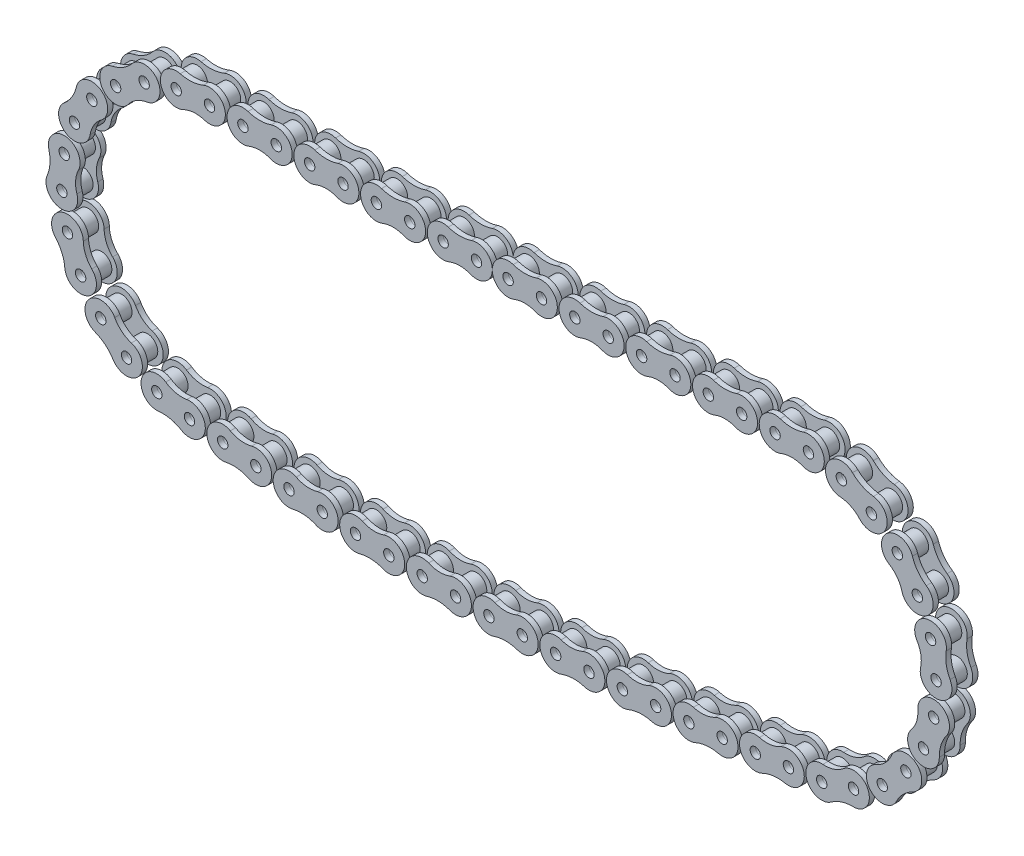
from build123d import *

# Parameters (mm, degrees)
SKETCH1_R            = 1.9812
BOSS_EXTRUDE1_DEPTH  = 2
SKETCH3_R            = 3.96367
SKETCH3_R_2          = 2.0574
BOSS_EXTRUDE2_DEPTH  = 7.9248
CRVPATTERN2_6_ANGLE  = 25.9221316
CRVPATTERN2_7_ANGLE  = 53.2058361
CRVPATTERN2_8_ANGLE  = 80.4895406
CRVPATTERN2_9_ANGLE  = 107.7732452
CRVPATTERN2_10_ANGLE = 135.0569497
CRVPATTERN2_11_ANGLE = 162.3406542
CRVPATTERN2_12_ANGLE = 172.9164261
CRVPATTERN2_13_ANGLE = 174.6442779
CRVPATTERN2_14_ANGLE = 176.3721297
CRVPATTERN2_15_ANGLE = 178.0999815
CRVPATTERN2_16_ANGLE = 179.8278334
CRVPATTERN2_17_ANGLE = 178.4443148
CRVPATTERN2_18_ANGLE = 176.716463
CRVPATTERN2_19_ANGLE = 174.9886112
CRVPATTERN2_20_ANGLE = 173.2607594
CRVPATTERN2_21_ANGLE = 167.7778612
CRVPATTERN2_22_ANGLE = 140.4941566
CRVPATTERN2_23_ANGLE = 113.2104521
CRVPATTERN2_24_ANGLE = 85.9267476
CRVPATTERN2_25_ANGLE = 58.643043
CRVPATTERN2_26_ANGLE = 31.3593385
CRVPATTERN2_27_ANGLE = 4.075634


with BuildPart() as part:
    # Sketch1 → Boss-Extrude1 (new body)
    with BuildSketch(Plane.XY):
        with BuildLine():
            ThreePointArc((-8.065136179, 5.713786682), (-16.0301374, -0.168817037), (-7.748496003, -5.596586996))
            ThreePointArc((-7.748496003, -5.596586996), (-3.65, -4.803078431), (0.448496003, -5.596586996))
            ThreePointArc((0.448496003, -5.596586996), (8.7301374, -0.168817037), (0.765136179, 5.713786682))
            ThreePointArc((0.765136179, 5.713786682), (-3.65, 4.986519632), (-8.065136179, 5.713786682))
        make_face()
        with Locations((-10, 0)):
            Circle(SKETCH1_R, mode=Mode.SUBTRACT)
        with Locations(Location((2.7, 0, 0), (0, 0, 180))):
            Circle(SKETCH1_R, mode=Mode.SUBTRACT)
    boss_extrude1 = extrude(amount=BOSS_EXTRUDE1_DEPTH)

    # Sketch3 → Boss-Extrude2 (add)
    # profile 1 of 2: a face of its own
    with BuildSketch(Plane.XY):
        with Locations((-10, 0)):
            Circle(SKETCH3_R)
        with Locations((-10, 0)):
            Circle(SKETCH3_R_2, mode=Mode.SUBTRACT)
    # profile 2 of 2: a face of its own
    with BuildSketch(Plane.XY):
        with Locations((2.7, 0)):
            Circle(SKETCH3_R)
        with Locations((2.7, 0)):
            Circle(SKETCH3_R_2, mode=Mode.SUBTRACT)
    extrude(amount=BOSS_EXTRUDE2_DEPTH)

    # Mirror1: Boss-Extrude1 across plane
    add(boss_extrude1.mirror(Plane.XY.offset(4.9624)))


with BuildPart() as body_2:
    # CrvPattern2: read off the stored shape, not the designer's step
    # CrvPattern2: copy of part
    add(part.part.moved(Location((24.7344319, 0, 0))))


with BuildPart() as body_3:
    # CrvPattern2 2: copy of part
    add(part.part.moved(Location((50.1344319, 0, 0))))


with BuildPart() as body_4:
    # CrvPattern2 3: copy of part
    add(part.part.moved(Location((75.5344319, 0, 0))))


with BuildPart() as body_5:
    # CrvPattern2 4: copy of part
    add(part.part.moved(Location((100.9344319, 0, 0))))


with BuildPart() as body_6:
    # CrvPattern2 5: copy of part
    add(part.part.moved(Location((126.3344319, 0, 0))))


with BuildPart() as body_7:
    # CrvPattern2 6: copy of part
    add(part.part.moved(Location((138.4486037, 59.5521123, 0))).rotate(Axis((0, 0, 0), (0, 0, -1)), CRVPATTERN2_6_ANGLE))


with BuildPart() as body_8:
    # CrvPattern2 7: copy of part
    add(part.part.moved(Location((120.6043286, 120.6522494, 0))).rotate(Axis((0, 0, 0), (0, 0, -1)), CRVPATTERN2_7_ANGLE))


with BuildPart() as body_9:
    # CrvPattern2 8: copy of part
    add(part.part.moved(Location((76.7371637, 166.7750934, 0))).rotate(Axis((0, 0, 0), (0, 0, -1)), CRVPATTERN2_8_ANGLE))


with BuildPart() as body_10:
    # CrvPattern2 9: copy of part
    add(part.part.moved(Location((16.6077599, 187.6580939, 0))).rotate(Axis((0, 0, 0), (0, 0, -1)), CRVPATTERN2_9_ANGLE))


with BuildPart() as body_11:
    # CrvPattern2 10: copy of part
    add(part.part.moved(Location((-46.4048065, 178.6546849, 0))).rotate(Axis((0, 0, 0), (0, 0, -1)), CRVPATTERN2_10_ANGLE))


with BuildPart() as body_12:
    # CrvPattern2 11: copy of part
    add(part.part.moved(Location((-98.2799423, 141.7681672, 0))).rotate(Axis((0, 0, 0), (0, 0, -1)), CRVPATTERN2_11_ANGLE))


with BuildPart() as body_13:
    # CrvPattern2 12: copy of part
    add(part.part.moved(Location((-97.2248015, 121.7115892, 0))).rotate(Axis((0, 0, 0), (0, 0, -1)), CRVPATTERN2_12_ANGLE))


with BuildPart() as body_14:
    # CrvPattern2 13: copy of part
    add(part.part.moved(Location((-75.4526496, 118.9976202, 0))).rotate(Axis((0, 0, 0), (0, 0, -1)), CRVPATTERN2_13_ANGLE))


with BuildPart() as body_15:
    # CrvPattern2 14: copy of part
    add(part.part.moved(Location((-53.608565, 116.9413621, 0))).rotate(Axis((0, 0, 0), (0, 0, -1)), CRVPATTERN2_14_ANGLE))


with BuildPart() as body_16:
    # CrvPattern2 15: copy of part
    add(part.part.moved(Location((-31.7124119, 115.5446846, 0))).rotate(Axis((0, 0, 0), (0, 0, -1)), CRVPATTERN2_15_ANGLE))


with BuildPart() as body_17:
    # CrvPattern2 16: copy of part
    add(part.part.moved(Location((-9.7841018, 114.8088578, 0))).rotate(Axis((0, 0, 0), (0, 0, -1)), CRVPATTERN2_16_ANGLE))


with BuildPart() as body_18:
    # CrvPattern2 17: copy of part
    add(part.part.moved(Location((12.1564248, 114.7345509, 0))).rotate(Axis((0, 0, 0), (0, 0, 1)), CRVPATTERN2_17_ANGLE))


with BuildPart() as body_19:
    # CrvPattern2 18: copy of part
    add(part.part.moved(Location((34.089216, 115.3218315, 0))).rotate(Axis((0, 0, 0), (0, 0, 1)), CRVPATTERN2_18_ANGLE))


with BuildPart() as body_20:
    # CrvPattern2 19: copy of part
    add(part.part.moved(Location((55.9943271, 116.5701655, 0))).rotate(Axis((0, 0, 0), (0, 0, 1)), CRVPATTERN2_19_ANGLE))


with BuildPart() as body_21:
    # CrvPattern2 20: copy of part
    add(part.part.moved(Location((77.8518384, 118.4784177, 0))).rotate(Axis((0, 0, 0), (0, 0, 1)), CRVPATTERN2_20_ANGLE))


with BuildPart() as body_22:
    # CrvPattern2 21: copy of part
    add(part.part.moved(Location((91.5139655, 126.949436, 0))).rotate(Axis((0, 0, 0), (0, 0, 1)), CRVPATTERN2_21_ANGLE))


with BuildPart() as body_23:
    # CrvPattern2 22: copy of part
    add(part.part.moved(Location((47.9965618, 159.0367736, 0))).rotate(Axis((0, 0, 0), (0, 0, 1)), CRVPATTERN2_22_ANGLE))


with BuildPart() as body_24:
    # CrvPattern2 23: copy of part
    add(part.part.moved(Location((-5.3881611, 167.6060805, 0))).rotate(Axis((0, 0, 0), (0, 0, 1)), CRVPATTERN2_23_ANGLE))


with BuildPart() as body_25:
    # CrvPattern2 24: copy of part
    add(part.part.moved(Location((-56.7618505, 150.7506453, 0))).rotate(Axis((0, 0, 0), (0, 0, 1)), CRVPATTERN2_24_ANGLE))


with BuildPart() as body_26:
    # CrvPattern2 25: copy of part
    add(part.part.moved(Location((-94.6936182, 112.220882, 0))).rotate(Axis((0, 0, 0), (0, 0, 1)), CRVPATTERN2_25_ANGLE))


with BuildPart() as body_27:
    # CrvPattern2 26: copy of part
    add(part.part.moved(Location((-110.7434668, 60.5898446, 0))).rotate(Axis((0, 0, 0), (0, 0, 1)), CRVPATTERN2_26_ANGLE))


with BuildPart() as body_28:
    # CrvPattern2 27: copy of part
    add(part.part.moved(Location((-101.3402294, 7.3456827, 0))).rotate(Axis((0, 0, 0), (0, 0, 1)), CRVPATTERN2_27_ANGLE))


with BuildPart() as body_29:
    # CrvPattern2 28: copy of part
    add(part.part.moved(Location((-76.2, 0, 0))))


with BuildPart() as body_30:
    # CrvPattern2 29: copy of part
    add(part.part.moved(Location((-50.8, 0, 0))))


with BuildPart() as body_31:
    # CrvPattern2 30: copy of part
    add(part.part.moved(Location((-25.4, 0, 0))))


solid = Compound([part.part, body_2.part, body_3.part, body_4.part, body_5.part, body_6.part, body_7.part, body_8.part, body_9.part, body_10.part, body_11.part, body_12.part, body_13.part, body_14.part, body_15.part, body_16.part, body_17.part, body_18.part, body_19.part, body_20.part, body_21.part, body_22.part, body_23.part, body_24.part, body_25.part, body_26.part, body_27.part, body_28.part, body_29.part, body_30.part, body_31.part])
